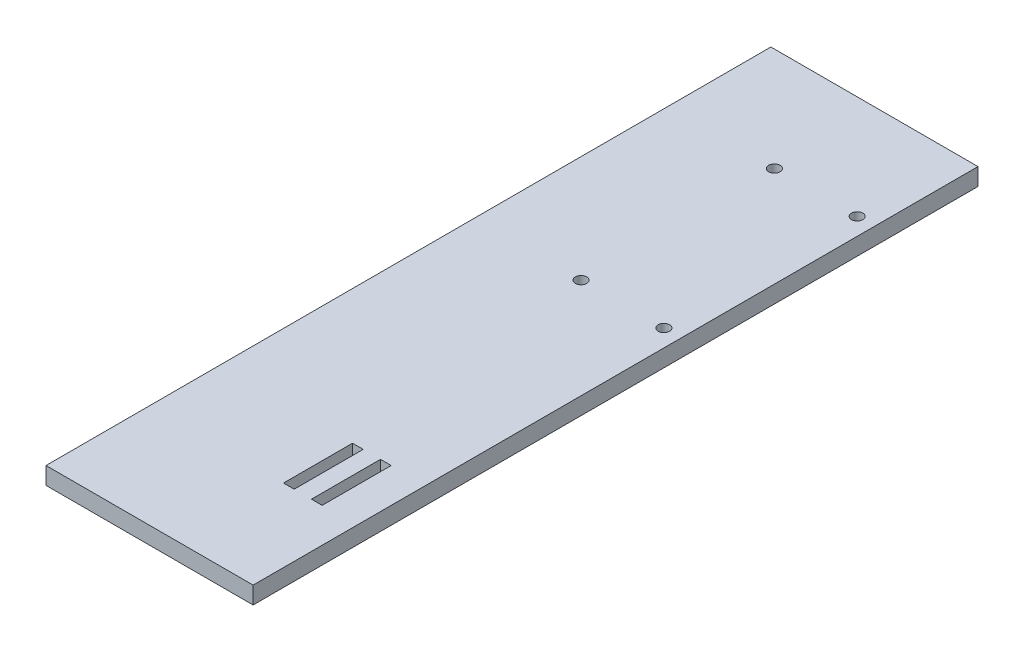
from build123d import *

# Parameters (mm, degrees)
SKETCH1_W           = 60
SKETCH1_H           = 210
BOSS_EXTRUDE1_DEPTH = 5
SKETCH2_W           = 3.1
SKETCH2_H           = 20
CUT_EXTRUDE1_DEPTH  = 5
SKETCH3_R           = 1.65
CUT_EXTRUDE2_DEPTH  = 5


with BuildPart() as part:
    # Sketch1 → Boss-Extrude1 (new body)
    with BuildSketch(Plane(origin=(0, 0, 0), x_dir=(1, 0, 0), z_dir=(0, 1, 0))):
        with Locations((30, 105)):
            Rectangle(SKETCH1_W, SKETCH1_H)
    extrude(amount=BOSS_EXTRUDE1_DEPTH)

    # Sketch2 → Cut-Extrude1 (cut)
    with BuildSketch(Plane(origin=(0, 5, 0), x_dir=(1, 0, 0), z_dir=(0, 1, 0))):
        with Locations((48.45, 40)):
            Rectangle(SKETCH2_W, SKETCH2_H)
        with Locations((40.35, 40)):
            Rectangle(SKETCH2_W, SKETCH2_H)
    extrude(amount=-CUT_EXTRUDE1_DEPTH, mode=Mode.SUBTRACT)

    # Sketch3 → Cut-Extrude2 (cut)
    with BuildSketch(Plane(origin=(0, 5, 0), x_dir=(1, 0, 0), z_dir=(0, 1, 0))):
        with Locations((55, 180)):
            Circle(SKETCH3_R)
        with Locations((55, 124)):
            Circle(SKETCH3_R)
        with Locations((31, 124)):
            Circle(SKETCH3_R)
        with Locations((31, 180)):
            Circle(SKETCH3_R)
    extrude(amount=-CUT_EXTRUDE2_DEPTH, mode=Mode.SUBTRACT)


solid = part.part
